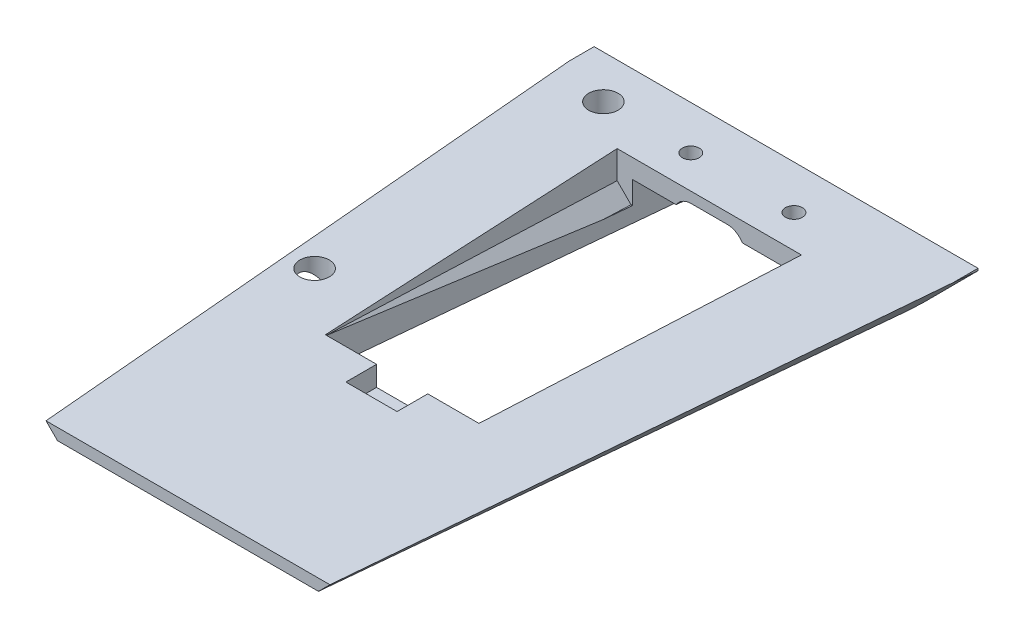
from build123d import *
from OCP.BRepFilletAPI import BRepFilletAPI_MakeChamfer

# Parameters (mm, degrees)
BOSS_EXTRUDE1_START = 126.292269218
BOSS_EXTRUDE1_DEPTH = 75
CHAMFER1_SIZE       = 12
CHAMFER2_SIZE       = 1.5
CHAMFER2_SIZE2      = 1.38459352
CUT_EXTRUDE1_REACH  = 228.979
SKETCH5_R           = 2.875
CUT_EXTRUDE2_DEPTH  = 227.978701072
SKETCH6_W           = 30
SKETCH6_H           = 15
SKETCH6_R           = 2.875
SKETCH6_H_2         = 60
CUT_EXTRUDE3_DEPTH  = 227.978701072
BOSS_EXTRUDE2_START = 148.792269218
BOSS_EXTRUDE2_DEPTH = 30
CUT_EXTRUDE4_DEPTH  = 30
SKETCH11_R          = 1.65
CUT_EXTRUDE5_DEPTH  = 227.978701072
SKETCH12_W          = 10
SKETCH12_H          = 3.906967626
CUT_EXTRUDE6_DEPTH  = 6
CHAMFER3_SIZE       = 2.7
CHAMFER3_SIZE2      = 2.711828512


# Read off the part's stored shape, not the designer's step: Boss-Extrude1, Boss-Extrude2
with BuildPart() as part:
    # Boss-Extrude1 outline → Boss-Extrude1 (new body)
    with BuildSketch(Plane.YZ.offset(BOSS_EXTRUDE1_START)):
        Polygon((-26.968617391, -104.155083501), (-14.5, -104.155083501), (-14.5, 12.696761663), (-16.745405627, 12.696761663), align=None)
    extrude(amount=BOSS_EXTRUDE1_DEPTH)

    # Chamfer1
    chamfer1_edges = [part.edges().sort_by_distance(p)[0] for p in [
        (201.292269218, -21.857011509, -45.729160919),
        (126.292269218, -21.857011509, -45.729160919),
    ]]
    chamfer(chamfer1_edges, length=CHAMFER1_SIZE)

    # Chamfer2
    chamfer2_edges = [part.edges().sort_by_distance(p)[0] for p in [
        (163.792269218, -26.968617391, -104.155083501),
    ]]
    chamfer2_side = [part.faces().sort_by_distance(p)[0] for p in [
        (163.792269218, -20.328588559, -104.155083501),
    ]]
    chamfer(chamfer2_edges, length=CHAMFER2_SIZE, length2=CHAMFER2_SIZE2, reference=chamfer2_side[0])

    # Cut-Extrude1: up to this plane
    cut_extrude1_end = Plane(origin=(0, -14.732006126, 1.288883527), z_dir=(0, -0.9961946980917461, 0.08715574274765119))
    # Sketch3 → Cut-Extrude1 (cut, up to the surface)
    with BuildSketch(Plane(origin=(0, -14.5, 0), x_dir=(1, 0, 0), z_dir=(0, 1, 0)), mode=Mode.PRIVATE) as cut_extrude1_sk1:
        Polygon((145.792269218, 89.155083501), (181.792269218, 89.155083501), (178.792269218, 29.155083501), (148.792269218, 29.155083501), align=None)
    cut_extrude1_tool1 = split(extrude(cut_extrude1_sk1.sketch, amount=-CUT_EXTRUDE1_REACH, mode=Mode.PRIVATE), bisect_by=cut_extrude1_end, keep=Keep.BOTH, mode=Mode.PRIVATE)
    add(cut_extrude1_tool1.solids().sort_by_distance((163.792269, -14.5, -60.064174))[0], mode=Mode.SUBTRACT)

    # Sketch5 → Cut-Extrude2 (cut, through all)
    with BuildSketch(Plane(origin=(0, -14.5, 0), x_dir=(1, 0, 0), z_dir=(0, 1, 0))):
        with Locations(Location((173.869198237, 95.613531365, 0), (0, 0, 270))):
            Circle(SKETCH5_R)
        with Locations(Location((136.518193504, 95.738532693, 0), (0, 0, 270))):
            Circle(SKETCH5_R)
        with Locations(Location((136.518193504, 39.320563904, 0), (0, 0, 270))):
            Circle(SKETCH5_R)
    extrude(amount=-CUT_EXTRUDE2_DEPTH, mode=Mode.SUBTRACT)

    # Sketch6 → Cut-Extrude3 (cut, through all)
    # profile 1 of 2: a face of its own
    with BuildSketch(Plane(origin=(0, -14.5, 0), x_dir=(1, 0, 0), z_dir=(0, 1, 0))):
        with Locations((163.792269218, 96.655083501)):
            Rectangle(SKETCH6_W, SKETCH6_H)
        with Locations((173.869198237, 95.613531365)):
            Circle(SKETCH6_R, mode=Mode.SUBTRACT)
    # profile 2 of 2: a face of its own
    with BuildSketch(Plane(origin=(0, -14.5, 0), x_dir=(1, 0, 0), z_dir=(0, 1, 0))):
        with Locations((163.792269218, 59.155083501)):
            Rectangle(SKETCH6_W, SKETCH6_H_2)
    extrude(amount=-CUT_EXTRUDE3_DEPTH, mode=Mode.SUBTRACT)

    # Boss-Extrude2 outline → Boss-Extrude2 (add)
    with BuildSketch(Plane.YZ.offset(BOSS_EXTRUDE2_START)):
        Polygon((-19.540350593, -104.155083501), (-14.5, -104.155083501), (-14.5, -89.155083501), (-18.22802064, -89.155083501), align=None)
    extrude(amount=BOSS_EXTRUDE2_DEPTH)

    # Sketch9 → Cut-Extrude4 (cut)
    with BuildSketch(Plane(origin=(0, -9.191601139, -105.06048176), x_dir=(-1, 0, 0), z_dir=(0, -0.08715574274765119, -0.9961946980917462))):
        with BuildLine():
            Line((-167.292269218, -8.738279996), (-160.292269218, -8.738279996))
            ThreePointArc((-160.292269218, -8.738279996), (-156.792269218, -12.238279996), (-160.292269218, -15.738279996))
            Line((-160.292269218, -15.738279996), (-167.292269218, -15.738279996))
            ThreePointArc((-167.292269218, -15.738279996), (-170.792269218, -12.238279996), (-167.292269218, -8.738279996))
        make_face()
    extrude(amount=-CUT_EXTRUDE4_DEPTH, mode=Mode.SUBTRACT)

    # Sketch11 → Cut-Extrude5 (cut, through all)
    with BuildSketch(Plane(origin=(0, -14.5, 0), x_dir=(1, 0, 0), z_dir=(0, 1, 0))):
        with Locations(Location((173.869198237, 95.613531365, 0), (0, 0, 270))):
            Circle(SKETCH11_R)
        with Locations(Location((153.7153402, 95.613531365, 0), (0, 0, 270))):
            Circle(SKETCH11_R)
    extrude(amount=-CUT_EXTRUDE5_DEPTH, mode=Mode.SUBTRACT)

    # Sketch12 → Cut-Extrude6 (cut)
    with BuildSketch(Plane(origin=(0, 0, -29.155083501), x_dir=(-1, 0, 0), z_dir=(0, 0, -1))):
        with Locations((-163.792269218, -16.453483813)):
            Rectangle(SKETCH12_W, SKETCH12_H)
    extrude(amount=-CUT_EXTRUDE6_DEPTH, mode=Mode.SUBTRACT)

    # Chamfer3: one chamfer whose edges measure the first distance from different faces: ONE call of the kernel's chamfer builder (chamfer() names one face for all edges)
    chamfer3_edges_1 = [part.edges().sort_by_distance(p)[0] for p in [
        (180.292269218, -20.020168019, -59.155083501),
    ]]
    chamfer3_side_1 = [part.faces().sort_by_distance(p)[0] for p in [
        (180.530002915, -17.468074044, -63.909757447),
    ]]
    chamfer3_edges_2 = [part.edges().sort_by_distance(p)[0] for p in [
        (147.292269218, -20.020168019, -59.155083501),
    ]]
    chamfer3_side_2 = [part.faces().sort_by_distance(p)[0] for p in [
        (147.054535521, -17.468074044, -63.909757447),
    ]]
    chamfer3 = BRepFilletAPI_MakeChamfer(part.part.solid().wrapped)
    for e in chamfer3_edges_1:
        chamfer3.Add(CHAMFER3_SIZE, CHAMFER3_SIZE2, e.wrapped, chamfer3_side_1[0].wrapped)  # the first distance lies on this face
    for e in chamfer3_edges_2:
        chamfer3.Add(CHAMFER3_SIZE, CHAMFER3_SIZE2, e.wrapped, chamfer3_side_2[0].wrapped)  # the first distance lies on this face
    add(Compound.cast(chamfer3.Shape()), mode=Mode.REPLACE)


solid = part.part
